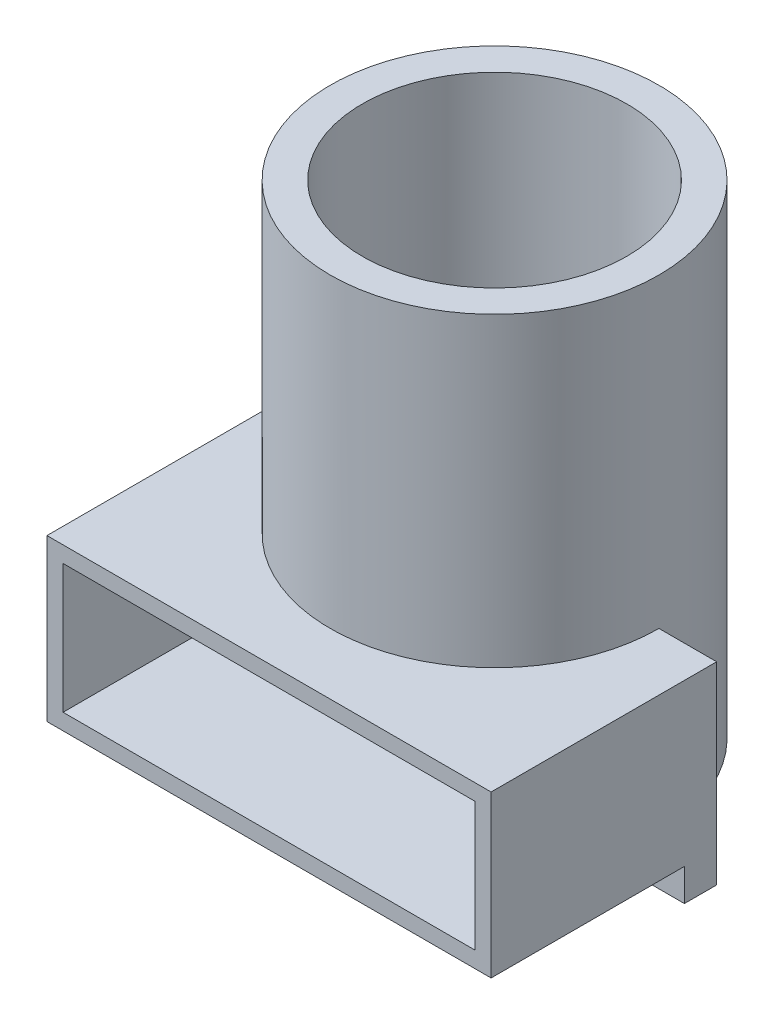
from build123d import *
from build123d.topology import SkipClean

# Parameters (mm, degrees)
SKETCH_2_R          = 259.207
SKETCH_2_R_2        = 208.407
F_19MM_DEPTH        = 482.6
F_11MM_START        = -279.4
F_11MM_DEPTH        = 279.4
SKETCH_8_W          = 700.278
SKETCH_8_H          = 254
EXTRUDE_2_DEPTH     = 355.6
SKETCH_11_W         = 649.478
SKETCH_11_H         = 203.2
CUT_EXTRUDE_1_DEPTH = 279.4
FILLET_2_R          = 127
SKETCH_13_W         = 700.278
SKETCH_13_H         = 50.8
F_2MM_DEPTH         = 50.8


with BuildPart() as part:
    # 草圖2 → 主件固定 19mm (new body)
    with BuildSketch(Plane(origin=(0, 0, 0), x_dir=(1, 0, 0), z_dir=(0, 1, 0))):
        Circle(SKETCH_2_R)
        Circle(SKETCH_2_R_2, mode=Mode.SUBTRACT)
    extrude(amount=F_19MM_DEPTH)

    # 草圖3 → 下填充 11mm (add)
    with SkipClean():  # the faces are left unmerged after this step: merging them gives an invalid solid
        with BuildSketch(Plane(origin=(0, 0, 0), x_dir=(1, 0, 0), z_dir=(0, 1, 0)).offset(F_11MM_START)):
            with BuildLine():
                ThreePointArc((208.407, 0), (0, 208.407), (-208.407, 0))
                Line((-208.407, 0), (-259.207, 0))
                ThreePointArc((-259.207, 0), (0, 259.207), (259.207, 0))
                Line((259.207, 0), (208.407, 0))
            make_face()
        extrude(amount=F_11MM_DEPTH)

    # 草圖8 → 填料-伸長2 (add)
    with SkipClean():  # the faces are left unmerged after this step: merging them gives an invalid solid
        with BuildSketch(Plane.XY):
            with Locations((0, -127)):
                Rectangle(SKETCH_8_W, SKETCH_8_H)
        extrude(amount=EXTRUDE_2_DEPTH)

    # 草圖11 → 除料-伸長1 (cut)
    with SkipClean():  # the faces are left unmerged after this step: merging them gives an invalid solid
        with BuildSketch(Plane.XY.offset(355.6)):
            with Locations((0, -127)):
                Rectangle(SKETCH_11_W, SKETCH_11_H)
        extrude(amount=-CUT_EXTRUDE_1_DEPTH, mode=Mode.SUBTRACT)

    # 圓角2
    # the kernel refuses this fillet: 127 mm, written as the material it takes off along each edge
    with BuildSketch(Plane(origin=(-525.907, 0, 0), x_dir=(0, 0, 1), z_dir=(1, 0, 0))) as fillet_2_piece_1_section:
        with BuildLine():
            CenterArc((FILLET_2_R, FILLET_2_R), FILLET_2_R, 180, 90)
            Line((0, FILLET_2_R), (0, 0))
            Line((0, 0), (FILLET_2_R, 0))
        make_face()
    fillet_2_piece_1 = extrude(amount=1051.814, mode=Mode.PRIVATE)
    fillet_2_piece_1 = fillet_2_piece_1 & Plane(origin=(0, -28.656065258, 0), x_dir=(1, 0, 0), z_dir=(0, -1, 0)) * Cylinder(208.407, 2612, mode=Mode.PRIVATE)
    add(fillet_2_piece_1, mode=Mode.SUBTRACT)

    # 草圖13 → 防水凸出2mm (add)
    with BuildSketch(Plane.XZ.offset(254)):
        with Locations((0, 25.4)):
            Rectangle(SKETCH_13_W, SKETCH_13_H)
    extrude(amount=F_2MM_DEPTH)


solid = part.part
